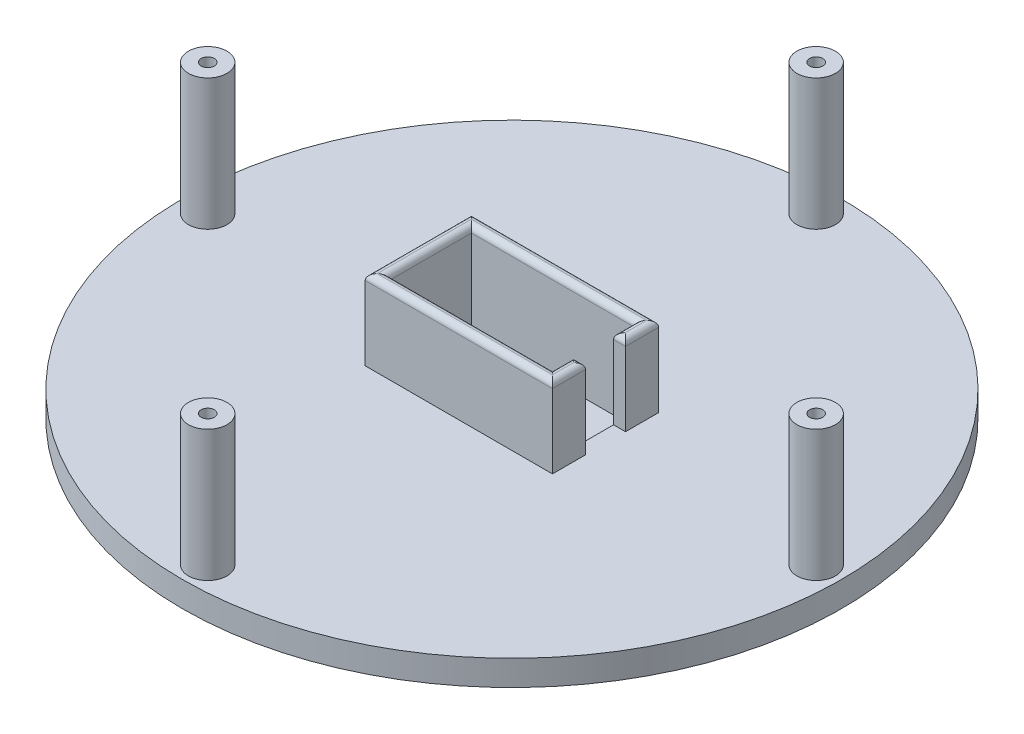
from build123d import *

# Parameters (mm, degrees)
SKETCH1_R           = 82.55
BOSS_EXTRUDE2_DEPTH = 6.35
SKETCH2_W           = 40.9
SKETCH2_H           = 20.6
CUT_EXTRUDE1_DEPTH  = 3.175
CUT_EXTRUDE2_REACH  = 118.916
SKETCH3_R           = 1.65
CIRPATTERN1_COUNT   = 4
BOSS_EXTRUDE3_START = 32.824999914
SKETCH5_R           = 4.825
SKETCH5_R_2         = 1.65
BOSS_EXTRUDE3_DEPTH = 32.824999914
CIRPATTERN3_COUNT   = 4
SKETCH4_R           = 2.9
CUT_EXTRUDE3_DEPTH  = 20
CIRPATTERN4_COUNT   = 4
BOSS_EXTRUDE5_DEPTH = 20
FILLET1_R           = 1.5


with BuildPart() as part:
    # Sketch1 → Boss-Extrude2 (new body)
    with BuildSketch(Plane(origin=(0, 0, 0), x_dir=(1, 0, 0), z_dir=(0, 1, 0))):
        with Locations(Location((0, 0, 0), (0, 0, 270))):
            Circle(SKETCH1_R)
    extrude(amount=BOSS_EXTRUDE2_DEPTH)

    # Sketch2 → Cut-Extrude1 (cut)
    with BuildSketch(Plane(origin=(0, 6.35, 0), x_dir=(1, 0, 0), z_dir=(0, 1, 0))):
        Rectangle(SKETCH2_W, SKETCH2_H)
    extrude(amount=-CUT_EXTRUDE1_DEPTH, mode=Mode.SUBTRACT)

    # Sketch3 → Cut-Extrude2 (cut, up to next)
    with BuildSketch(Plane(origin=(0, 6.35, 0), x_dir=(1, 0, 0), z_dir=(0, 1, 0)), mode=Mode.PRIVATE) as cut_extrude2_sk1:
        with Locations(Location((0, 76.2, 0), (0, 0, 270))):
            Circle(SKETCH3_R)
    cut_extrude2_tool1 = extrude(cut_extrude2_sk1.sketch, amount=-CUT_EXTRUDE2_REACH, mode=Mode.PRIVATE) & part.part
    cut_extrude2 = cut_extrude2_tool1.solids().sort_by_distance((0, 6.35, -76.2))[0]
    add(cut_extrude2, mode=Mode.SUBTRACT)

    # CirPattern1: Cut-Extrude2 ×4 about axis
    cirpattern1_axis = Axis((0, 0, 0), (0, 1, 0))
    for i in range(1, CIRPATTERN1_COUNT):
        add(cut_extrude2.rotate(cirpattern1_axis, i * 360 / CIRPATTERN1_COUNT), mode=Mode.SUBTRACT)

    # Sketch5 → Boss-Extrude3 (add)
    with BuildSketch(Plane(origin=(0, 6.35, 0), x_dir=(1, 0, 0), z_dir=(0, 1, 0)).offset(BOSS_EXTRUDE3_START)):
        with Locations(Location((0, 76.2, 0), (0, 0, 270))):
            Circle(SKETCH5_R)
        with Locations(Location((0, 76.2, 0), (0, 0, 270))):
            Circle(SKETCH5_R_2, mode=Mode.SUBTRACT)
    boss_extrude3 = extrude(amount=-BOSS_EXTRUDE3_DEPTH)

    # CirPattern3: Boss-Extrude3 ×4 about axis
    cirpattern3_axis = Axis((0, 0, 0), (0, 1, 0))
    for i in range(1, CIRPATTERN3_COUNT):
        add(boss_extrude3.rotate(cirpattern3_axis, i * 360 / CIRPATTERN3_COUNT))

    # Sketch4 → Cut-Extrude3 (cut)
    with BuildSketch(Plane.XZ):
        with Locations(Location((-76.2, 0, 0), (0, 0, 270))):
            Circle(SKETCH4_R)
    cut_extrude3 = extrude(amount=-CUT_EXTRUDE3_DEPTH, mode=Mode.SUBTRACT)

    # CirPattern4: Cut-Extrude3 ×4 about axis
    cirpattern4_axis = Axis((0, 0, 0), (0, 1, 0))
    for i in range(1, CIRPATTERN4_COUNT):
        add(cut_extrude3.rotate(cirpattern4_axis, i * 360 / CIRPATTERN4_COUNT), mode=Mode.SUBTRACT)

    # Sketch6 → Boss-Extrude5 (add)
    with BuildSketch(Plane(origin=(0, 6.35, 0), x_dir=(1, 0, 0), z_dir=(0, 1, 0))):
        Polygon((-20.45, 10.3), (20.45, 10.3), (20.45, 5), (23.45, 5), (23.45, 13.3), (-23.45, 13.3), (-23.45, -13.3), (23.45, -13.3), (23.45, -5), (20.45, -5), (20.45, -10.3), (-20.45, -10.3), align=None)
    extrude(amount=BOSS_EXTRUDE5_DEPTH)

    # Fillet1
    fillet1_edges = [part.edges().sort_by_distance(p)[0] for p in [
        (23.45, 26.35, -9.15),
        (0, 26.35, -13.3),
        (-23.45, 26.35, 0),
        (0, 26.35, 13.3),
        (23.45, 26.35, 9.15),
        (21.95, 26.35, 5),
        (20.45, 26.35, 7.65),
        (0, 26.35, 10.3),
        (-20.45, 26.35, 0),
        (0, 26.35, -10.3),
        (20.45, 26.35, -7.65),
        (21.95, 26.35, -5),
    ]]
    fillet(fillet1_edges, radius=FILLET1_R - 0.0001)  # a hair under: the kernel refuses the full size


solid = part.part
